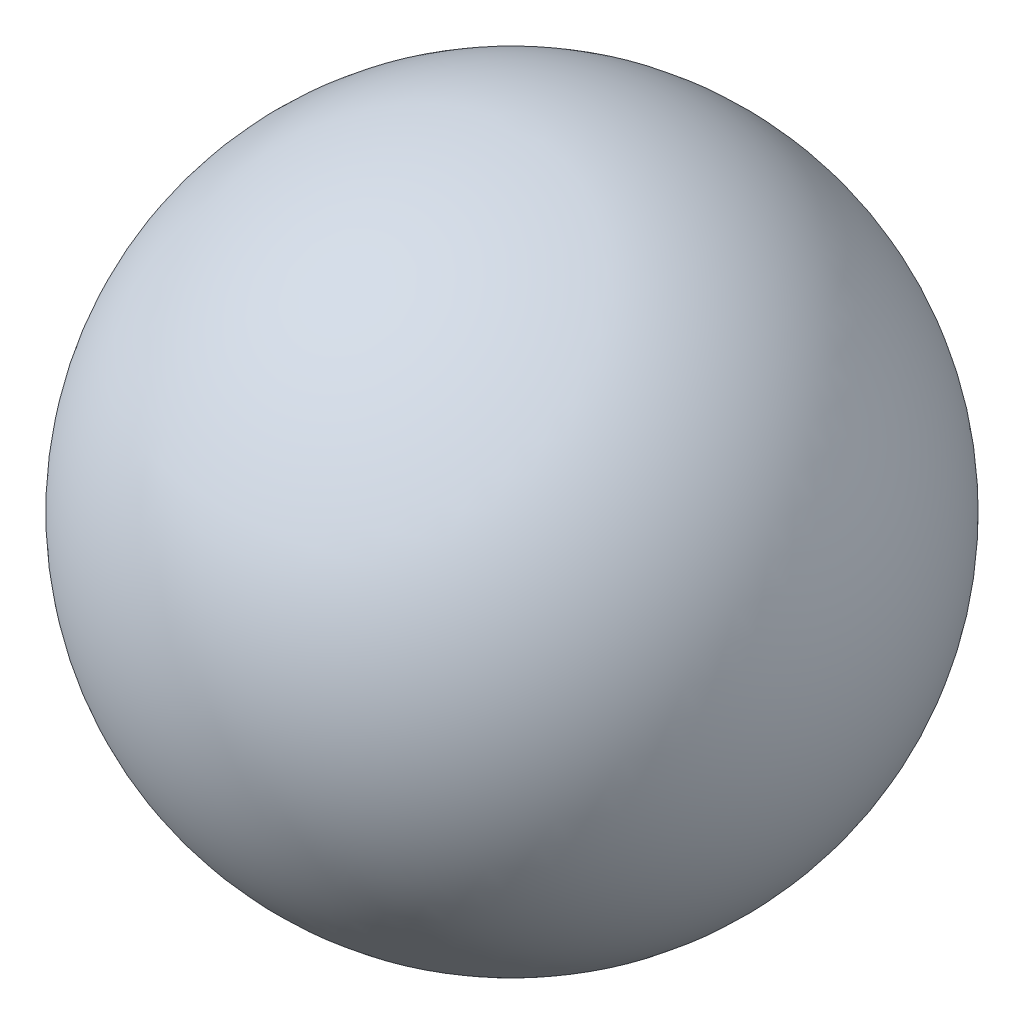
from build123d import *


with BuildPart() as part:
    # Sketch1 → Revolve3 (revolve)
    with BuildSketch(Plane.XY):
        with BuildLine():
            ThreePointArc((0, 30), (-15, 15), (0, 0))
            Line((0, 0), (0, 30))
        make_face()
    revolve(axis=Axis((0, 0, 0), (0, 1, 0)))


solid = part.part
